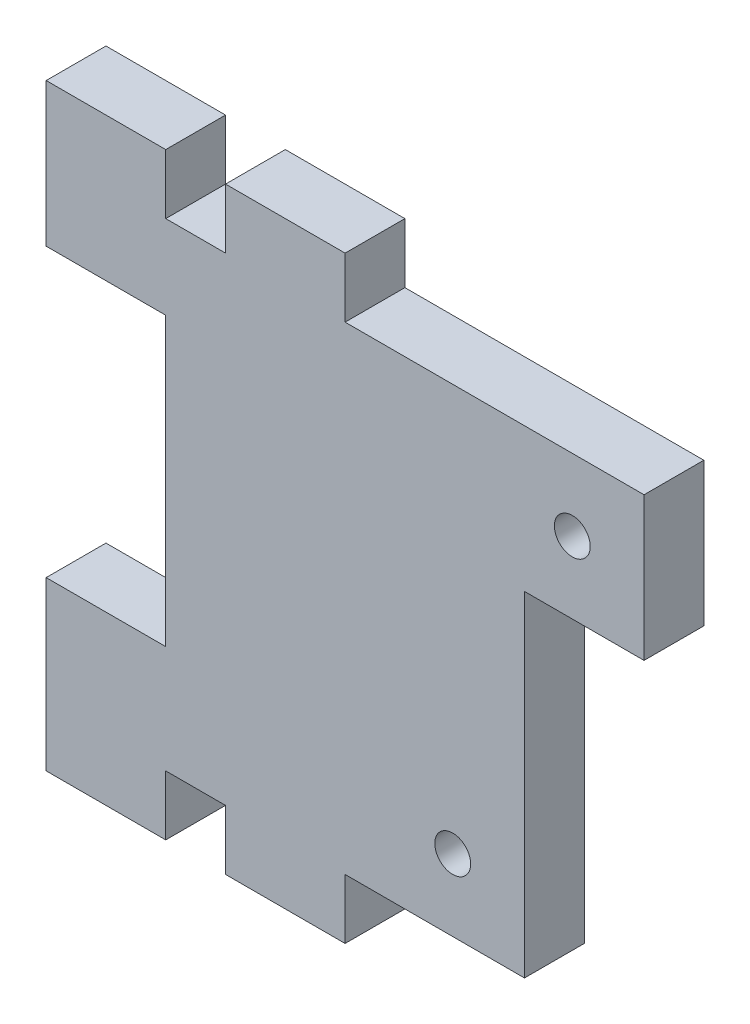
from build123d import *

# Parameters (mm, degrees)
ESQUISSE1_R        = 1.5
BOSS_EXTRU_1_DEPTH = 5


with BuildPart() as part:
    # Esquisse1 → Boss.-Extru.1 (new body)
    with BuildSketch(Plane.XY):
        Polygon((10, 0), (15, 0), (15, -5), (25, -5), (25, 0), (40, 0), (40, 28), (50, 28), (50, 40), (25, 40), (25, 45), (15, 45), (15, 40), (10, 40), (10, 45), (0, 45), (0, 40), (0, 33), (10, 33), (10, 9), (0, 9), (0, 0), (0, -5), (10, -5), align=None)
        with Locations((44, 34)):
            Circle(ESQUISSE1_R, mode=Mode.SUBTRACT)
        with Locations((34, 6)):
            Circle(ESQUISSE1_R, mode=Mode.SUBTRACT)
    extrude(amount=BOSS_EXTRU_1_DEPTH)


solid = part.part
